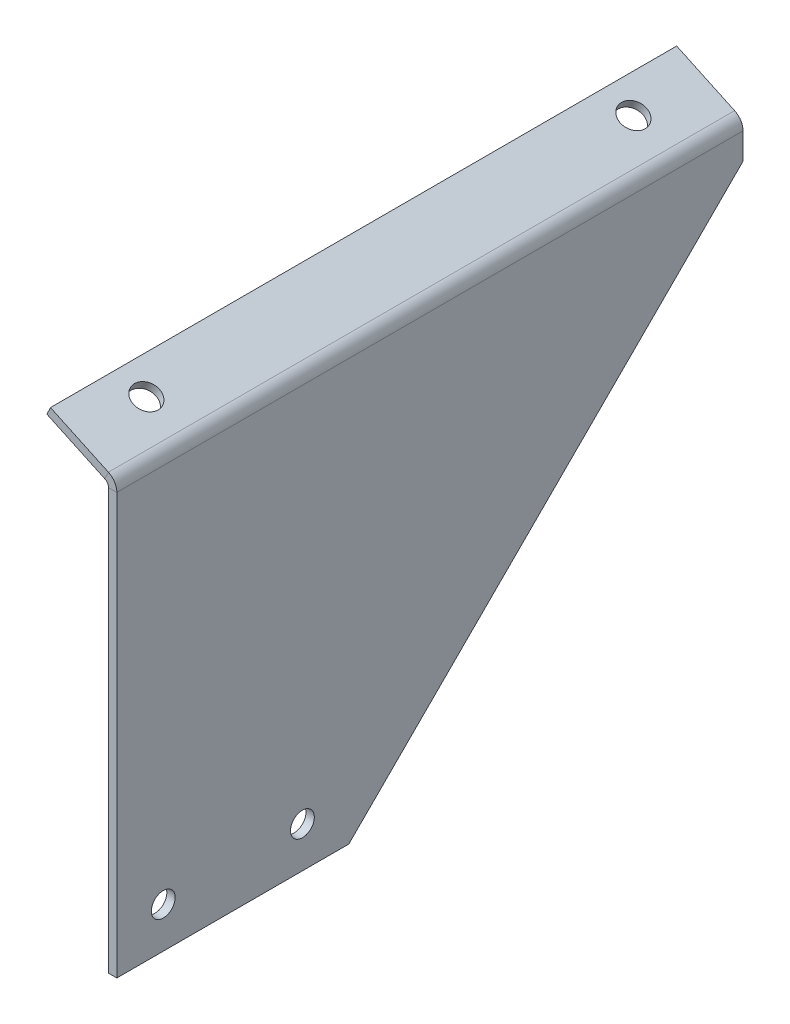
from build123d import *

# Parameters (mm, degrees)
BASE_FLANGE1_DEPTH         = 2.286
CUT_EXTRUDE1_REACH         = 196.797
SKETCH4_R                  = 3.2639
SKETCH4_R_2                = 3.5687
SKETCHED_START             = 119.049056405
SKETCHED_BEND2_OUTLINE_R   = 3.5687
SKETCHED_BEND2_DEPTH       = 4.950943595
SKETCHED_START_2           = -139.7
SKETCHED_BEND2_2_DEPTH     = 171.45
SKETCHED_BEND2_3_DEPTH     = 171.45
SKETCHED_START_3           = 104.381009176
SKETCHED_BEND2_4_OUTLINE_R = 3.5687
SKETCHED_BEND2_4_DEPTH     = 2.286


with BuildPart() as part:
    # Base-Flange1: sheet metal written as solids
    # Sketch2 → Base-Flange1 (new body)
    with BuildSketch(Plane(origin=(0, 0, 0), x_dir=(0, 0, -1), z_dir=(1, 0, 0))):
        Polygon((-31.75, 0), (31.75, 0), (139.7, 107.95), (139.7, 135.7376), (-31.75, 135.7376), align=None)
    extrude(amount=-BASE_FLANGE1_DEPTH)

    # Sketch4 → Cut-Extrude1 (cut, up to next)
    with BuildSketch(Plane(origin=(0, 0, 0), x_dir=(0, 0, -1), z_dir=(1, 0, 0)), mode=Mode.PRIVATE) as cut_extrude1_sk1:
        with Locations((19.05, 11.1252)):
            Circle(SKETCH4_R)
    cut_extrude1_tool1 = extrude(cut_extrude1_sk1.sketch, amount=-CUT_EXTRUDE1_REACH, mode=Mode.PRIVATE) & part.part
    # Sketch4 → Cut-Extrude1 (cut, up to next)
    with BuildSketch(Plane(origin=(0, 0, 0), x_dir=(0, 0, -1), z_dir=(1, 0, 0)), mode=Mode.PRIVATE) as cut_extrude1_sk2:
        with Locations((-19.05, 11.1252)):
            Circle(SKETCH4_R)
    cut_extrude1_tool2 = extrude(cut_extrude1_sk2.sketch, amount=-CUT_EXTRUDE1_REACH, mode=Mode.PRIVATE) & part.part
    # Sketch4 → Cut-Extrude1 (cut, up to next)
    with BuildSketch(Plane(origin=(0, 0, 0), x_dir=(0, 0, -1), z_dir=(1, 0, 0)), mode=Mode.PRIVATE) as cut_extrude1_sk3:
        with Locations((-12.7, 127.7874)):
            Circle(SKETCH4_R_2)
    cut_extrude1_tool3 = extrude(cut_extrude1_sk3.sketch, amount=-CUT_EXTRUDE1_REACH, mode=Mode.PRIVATE) & part.part
    # Sketch4 → Cut-Extrude1 (cut, up to next)
    with BuildSketch(Plane(origin=(0, 0, 0), x_dir=(0, 0, -1), z_dir=(1, 0, 0)), mode=Mode.PRIVATE) as cut_extrude1_sk4:
        with Locations((120.65, 127.7874)):
            Circle(SKETCH4_R_2)
    cut_extrude1_tool4 = extrude(cut_extrude1_sk4.sketch, amount=-CUT_EXTRUDE1_REACH, mode=Mode.PRIVATE) & part.part
    add(cut_extrude1_tool1.solids().sort_by_distance((0, 11.1252, -19.05))[0], mode=Mode.SUBTRACT)
    add(cut_extrude1_tool2.solids().sort_by_distance((0, 11.1252, 19.05))[0], mode=Mode.SUBTRACT)
    add(cut_extrude1_tool3.solids().sort_by_distance((0, 127.7874, 12.7))[0], mode=Mode.SUBTRACT)
    add(cut_extrude1_tool4.solids().sort_by_distance((0, 127.7874, -120.65))[0], mode=Mode.SUBTRACT)

    # Sketched Bend2: read off the stored shape, not the designer's step
    # Sketched Bend2 outline → Sketched Bend2 (cut)
    with BuildSketch(Plane(origin=(0, 0, 0), x_dir=(0.906307787036651, -0.42261826174069705, 0), z_dir=(0.42261826174069705, 0.9063077870366512, 0)).offset(SKETCHED_START)):
        with Locations((-61.845865858, -12.7)):
            Circle(SKETCHED_BEND2_OUTLINE_R)
        with Locations((-61.845865858, 120.65)):
            Circle(SKETCHED_BEND2_OUTLINE_R)
    extrude(amount=SKETCHED_BEND2_DEPTH, mode=Mode.SUBTRACT)

    # Sketched Bend2 2 outline → Sketched Bend2 2 (cut)
    with BuildSketch(Plane.XY.offset(SKETCHED_START_2)):
        with BuildLine():
            Line((-2.286, 135.7376), (-2.286, 118.759838882))
            ThreePointArc((-2.286, 118.759838882), (-0.619280932, 117.279080961), (0, 115.137332236))
            Line((0, 115.137332236), (0, 135.7376))
            Line((0, 135.7376), (-2.286, 135.7376))
        make_face()
    extrude(amount=SKETCHED_BEND2_2_DEPTH, mode=Mode.SUBTRACT)

    # Sketched Bend2 3 outline → Sketched Bend2 3 (add)
    with BuildSketch(Plane.XY.offset(SKETCHED_START_2)):
        with BuildLine():
            Line((-19.143397335, 124.098413464), (-3.283253738, 116.702707046))
            ThreePointArc((-3.283253738, 116.702707046), (-2.556494295, 116.065356119), (-2.286, 115.137332236))
            Line((-2.286, 115.137332236), (-2.286, 118.759838882))
            ThreePointArc((-2.286, 118.759838882), (-2.301558441, 118.767216176), (-2.317148392, 118.774526647))
            Line((-2.317148392, 118.774526647), (-18.177291988, 126.170233065))
            Line((-18.177291988, 126.170233065), (-19.143397335, 124.098413464))
        make_face()
    extrude(amount=SKETCHED_BEND2_3_DEPTH)

    # Sketched Bend2 4 outline → Sketched Bend2 4 (cut)
    with BuildSketch(Plane(origin=(0, 0, 0), x_dir=(0.906307787036651, -0.42261826174069705, 0), z_dir=(0.42261826174069705, 0.9063077870366512, 0)).offset(SKETCHED_START_3)):
        with Locations((-61.845865858, -12.7)):
            Circle(SKETCHED_BEND2_4_OUTLINE_R)
        with Locations((-61.845865858, 120.65)):
            Circle(SKETCHED_BEND2_4_OUTLINE_R)
    extrude(amount=SKETCHED_BEND2_4_DEPTH, mode=Mode.SUBTRACT)


solid = part.part
